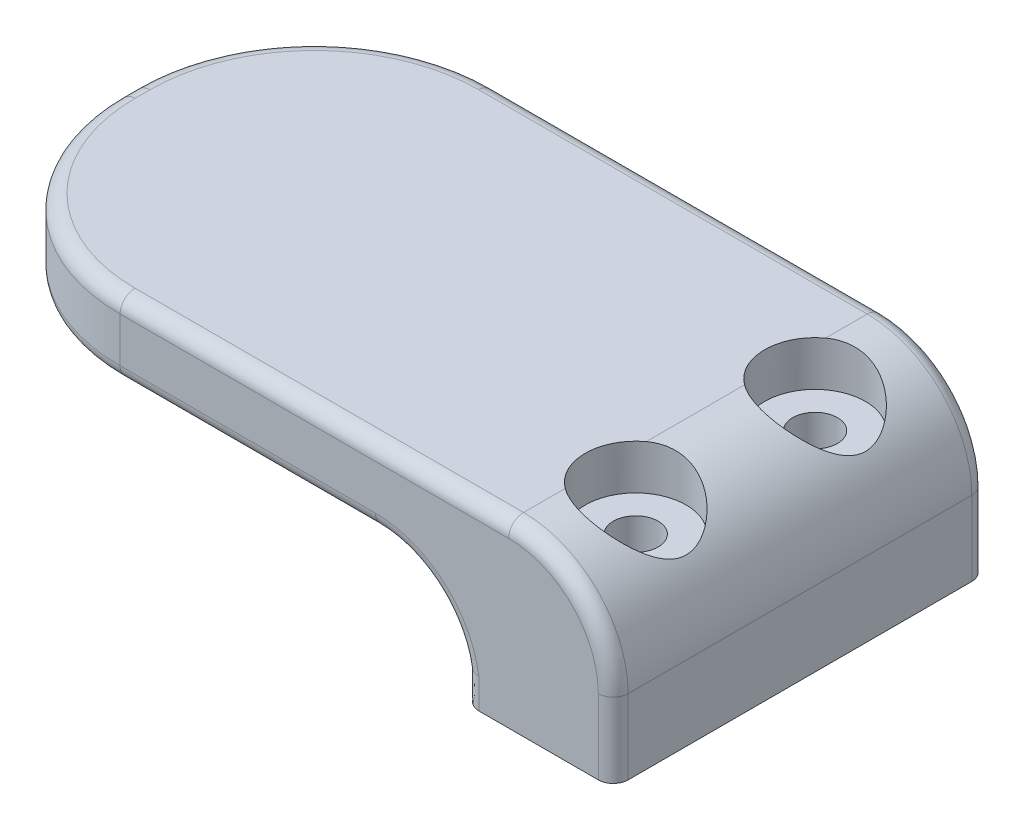
from build123d import *

# Parameters (mm, degrees)
SALIENTE_EXTRUIR1_DEPTH    = 12.5
REDONDEO1_R                = 12
REDONDEO2_R                = 6
REDONDEO3_R                = 1
CROQUIS4_R                 = 2.375
SALIENTE_EXTRUIR3_DEPTH    = 12
REDONDEO4_R                = 0.5
REDONDEO5_R                = 2
SALIENTE_EXTRUIR4_DEPTH    = 2
CORTAR_EXTRUIR1_DEPTH      = 28.61340267
CORTAR_EXTRUIR1_DEPTH_BACK = 28.61340267
REDONDEO6_R                = 7
CROQUIS8_R                 = 3.375
CORTAR_EXTRUIR2_DEPTH      = 3


with BuildPart() as part:
    # Croquis2 → Saliente-Extruir1 (new, symmetric)
    with BuildSketch(Plane.XY):
        Polygon((-22.5, -2.5), (12.5, -2.5), (12.5, -7.5), (22.5, -7.5), (22.5, -2.5), (22.5, 2.5), (-22.5, 2.5), align=None)
    extrude(amount=SALIENTE_EXTRUIR1_DEPTH, both=True)

    # Redondeo1
    redondeo1_edges = [part.edges().sort_by_distance(p)[0] for p in [
        (-22.5, 0, 12.5),
        (-22.5, 0, -12.5),
    ]]
    fillet(redondeo1_edges, radius=REDONDEO1_R)

    # Redondeo2
    # the kernel refuses this fillet: 6 mm, written as the material it adds along each edge
    with BuildSketch(Plane(origin=(12.5, -2.5, -12.5), x_dir=(-1, 0, 0), z_dir=(0, 0, 1))) as redondeo2_piece_1:
        with BuildLine():
            CenterArc((5.916079783, 6), REDONDEO2_R, 189.594068227, 80.405931773)
            Line((0, 5), (-0.118321596, 4.98))
            ThreePointArc((-0.118321596, 4.98), (-0.12, 2.5), (-0.12, 0))
            Line((-0.12, 0), (0, -0.12))
            Line((0, -0.12), (5.916079783, -0.12))
            Line((5.916079783, -0.12), (5.916079783, 0))
        make_face()
    extrude(amount=25)

    # Redondeo3
    redondeo3_edges = [part.edges().sort_by_distance(p)[0] for p in [
        (-22.5, -2.5, 0),
        (-22.5, 2.5, 0),
        (-1.958039892, -2.5, -12.5),
        (-1.958039892, -2.5, 12.5),
        (-18.985281374, -2.5, 8.985281374),
        (-18.985281374, -2.5, -8.985281374),
        (-18.985281374, 2.5, 8.985281374),
        (-18.985281374, 2.5, -8.985281374),
        (10.456903563, -3.917424305, -12.5),
        (10.456903563, -3.917424305, 12.5),
        (22.5, -2.5, 12.5),
        (22.5, -2.5, -12.5),
        (6, 2.5, 12.5),
        (6, 2.5, -12.5),
    ]]
    fillet(redondeo3_edges, radius=REDONDEO3_R)

    # Croquis4 → Saliente-Extruir3 (add)
    with BuildSketch(Plane(origin=(0, 2.5, 0), x_dir=(1, 0, 0), z_dir=(0, 1, 0))):
        with Locations(Location((-9.5, 0, 0), (0, 0, 270))):
            Circle(CROQUIS4_R)
    extrude(amount=-SALIENTE_EXTRUIR3_DEPTH)

    # Redondeo4
    redondeo4_edges = [part.edges().sort_by_distance(p)[0] for p in [
        (-9.5, -9.5, -2.375),
    ]]
    fillet(redondeo4_edges, radius=REDONDEO4_R)

    # Redondeo5
    redondeo5_edges = [part.edges().sort_by_distance(p)[0] for p in [
        (-9.5, -2.5, -2.375),
    ]]
    fillet(redondeo5_edges, radius=REDONDEO5_R)

    # Croquis7 → Saliente-Extruir4 (add)
    with BuildSketch(Plane.XZ.offset(7.5)):
        with BuildLine():
            Line((12.5, 11.5), (12.5, -11.5))
            add(Edge.make_bspline(
                [(12.5, -11.5), (12.5, -11.632848265), (12.526734482, -11.763242783), (12.62923764, -12.005921342), (12.70502711, -12.11688233), (12.892075524, -12.300681325), (13.00482188, -12.374695974), (13.247304361, -12.47373544), (13.379319354, -12.5), (13.512123447, -12.5)],
                knots=[0, 0, 0, 0, 0.25, 0.25, 0.5, 0.5, 0.75, 0.75, 1, 1, 1, 1], degree=3))
            Line((13.512123447, -12.5), (21.5, -12.5))
            ThreePointArc((21.5, -12.5), (22.207106781, -12.207106781), (22.5, -11.5))
            Line((22.5, -11.5), (22.5, 11.5))
            ThreePointArc((22.5, 11.5), (22.207106781, 12.207106781), (21.5, 12.5))
            Line((21.5, 12.5), (13.512123447, 12.5))
            add(Edge.make_bspline(
                [(13.512123447, 12.5), (13.379290266, 12.5), (13.249021118, 12.474311205), (13.004761707, 12.374795975), (12.892729967, 12.301196052), (12.611695188, 12.025427443), (12.5, 11.765753932), (12.5, 11.5)],
                knots=[0, 0, 0, 0, 0.25, 0.25, 0.5, 0.5, 1, 1, 1, 1], degree=3))
        make_face()
    extrude(amount=SALIENTE_EXTRUIR4_DEPTH)

    # Croquis6 → Cortar-Extruir1 (cut, two sides: drawn at the far end of the back side and taken through both)
    with BuildSketch(Plane.XZ.offset(7.5).offset(-CORTAR_EXTRUIR1_DEPTH_BACK)):
        with BuildLine():
            ThreePointArc((19.006061724, 6), (18.566721895, 7.060660172), (17.506061724, 7.5))
            Line((17.506061724, 7.5), (17.506061724, 4.5))
            ThreePointArc((17.506061724, 4.5), (18.566721895, 4.939339828), (19.006061724, 6))
        make_face()
        with BuildLine():
            Line((17.506061724, 4.5), (17.506061724, 7.5))
            ThreePointArc((17.506061724, 7.5), (16.006061724, 6), (17.506061724, 4.5))
        make_face()
        with BuildLine():
            ThreePointArc((19.006061724, -6), (18.566721895, -4.939339828), (17.506061724, -4.5))
            Line((17.506061724, -4.5), (17.506061724, -7.5))
            ThreePointArc((17.506061724, -7.5), (18.566721895, -7.060660172), (19.006061724, -6))
        make_face()
        with BuildLine():
            Line((17.506061724, -7.5), (17.506061724, -4.5))
            ThreePointArc((17.506061724, -4.5), (16.006061724, -6), (17.506061724, -7.5))
        make_face()
    extrude(amount=CORTAR_EXTRUIR1_DEPTH + CORTAR_EXTRUIR1_DEPTH_BACK, mode=Mode.SUBTRACT)

    # Redondeo6
    # the kernel refuses this fillet: 7 mm, written as the material it takes off along each edge
    with BuildSketch(Plane(origin=(15.5, -4.5, 12.5), x_dir=(1, 0, 0), z_dir=(0, -1, 0))) as redondeo6_piece_1:
        with BuildLine():
            CenterArc((6, -1), 1, 0, 90)
            Line((7, -1), (7, 0))
            Line((7, 0), (6, 0))
        make_face()
    revolve(axis=Axis((15.5, -4.5, 12.5), (0, 0, 1)), revolution_arc=90, mode=Mode.SUBTRACT)
    with BuildSketch(Plane(origin=(15.5, -4.5, -12.5), x_dir=(0, 1, 0), z_dir=(-1, 0, 0))) as redondeo6_piece_2:
        with BuildLine():
            CenterArc((6, -1), 1, 0, 90)
            Line((7, -1), (7, 0))
            Line((7, 0), (6, 0))
        make_face()
    revolve(axis=Axis((15.5, -4.5, -12.5), (0, 0, -1)), revolution_arc=90, mode=Mode.SUBTRACT)
    with BuildSketch(Plane(origin=(22.5, 2.5, 12.5), x_dir=(0, -1, 0), z_dir=(0, 0, -1))) as redondeo6_piece_3:
        with BuildLine():
            CenterArc((REDONDEO6_R, REDONDEO6_R), REDONDEO6_R, 180, 90)
            Line((0, REDONDEO6_R), (0, 0))
            Line((0, 0), (REDONDEO6_R, 0))
        make_face()
    extrude(amount=25, mode=Mode.SUBTRACT)

    # Croquis8 → Cortar-Extruir2 (cut)
    with BuildSketch(Plane(origin=(0, 2.5, 0), x_dir=(1, 0, 0), z_dir=(0, 1, 0))):
        with Locations(Location((17.506061724, -6, 0), (0, 0, 270))):
            Circle(CROQUIS8_R)
        with Locations(Location((17.506061724, 6, 0), (0, 0, 270))):
            Circle(CROQUIS8_R)
    extrude(amount=-CORTAR_EXTRUIR2_DEPTH, mode=Mode.SUBTRACT)


solid = part.part
